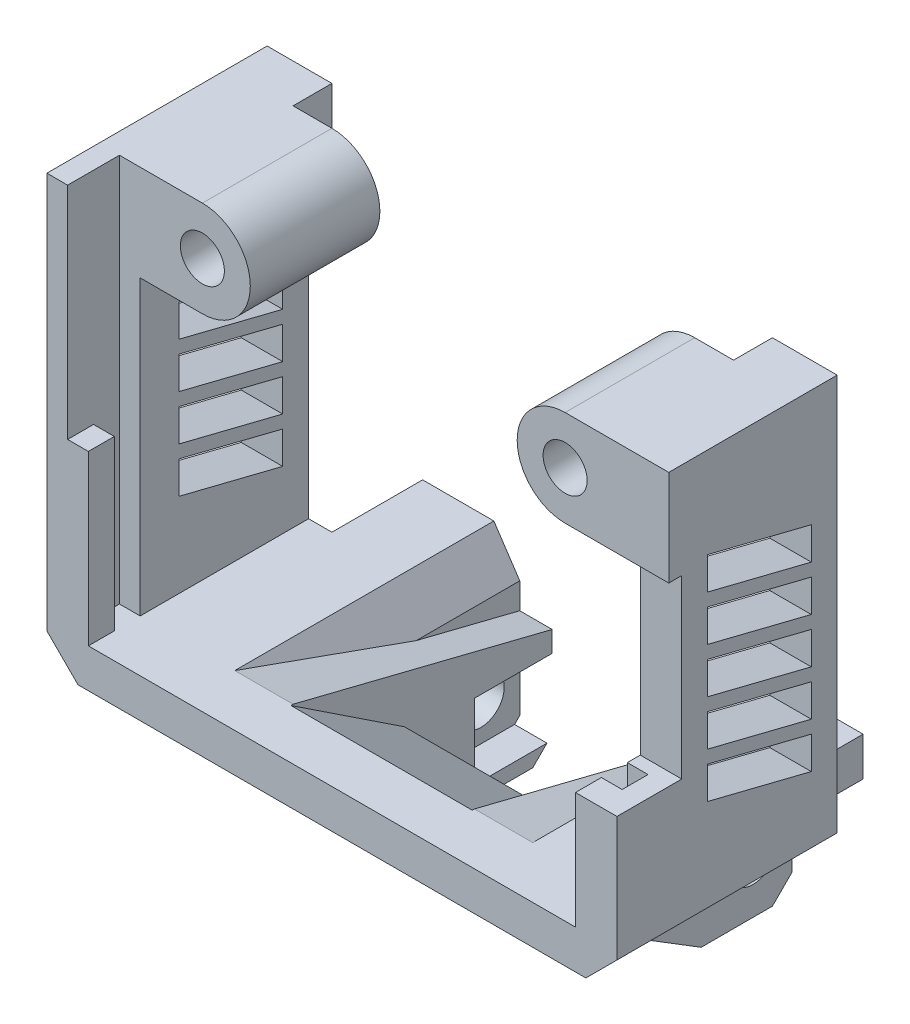
from build123d import *

# Parameters (mm, degrees)
SKETCH_1_W           = 44
SKETCH_1_H           = 34
EXTRUDE_1_DEPTH      = 24
CUT_EXTRUDE_1_DEPTH  = 31
SKETCH_5_W           = 23
SKETCH_5_H           = 10.5
EXTRUDE_4_DEPTH      = 1
EXTRUDE_5_DEPTH      = 23
SKETCH_7_R           = 1.8
CUT_EXTRUDE_2_DEPTH  = 23
CUT_EXTRUDE_4_DEPTH  = 19
CHAMFER_2_SIZE       = 2
CHAMFER_2_SIZE2      = 3
SKETCH_11_R          = 1.7
EXTRUDE_6_DEPTH      = 20
CUT_EXTRUDE_7_DEPTH  = 4
CHAMFER_3_SIZE       = 2.4
SKETCH_14_W          = 40.8
SKETCH_14_H          = 4
CUT_EXTRUDE_8_DEPTH  = 18
SKETCH_15_W          = 44
SKETCH_15_H          = 1
CUT_EXTRUDE_9_DEPTH  = 24
SKETCH_16_W          = 3.2
SKETCH_16_H          = 13.6
CUT_EXTRUDE_10_DEPTH = 5
SKETCH_17_W          = 1.6
SKETCH_17_H          = 4
CUT_EXTRUDE_11_DEPTH = 7.4
CUT_EXTRUDE_12_DEPTH = 7
SKETCH_19_W          = 1
SKETCH_19_H          = 10.5
CUT_EXTRUDE_13_DEPTH = 23
CHAMFER_4_SIZE       = 1.5
CHAMFER_5_SIZE       = 3
CHAMFER_5_SIZE2      = 2
CUT_EXTRUDE_START    = -3
SKETCH_20_W          = 14
SKETCH_20_H          = 11.956557484
CUT_EXTRUDE_14_DEPTH = 17
CHAMFER_6_SIZE       = 10
CHAMFER_6_SIZE_2     = 4
CHAMFER_7_SIZE       = 1
SKETCH_22_W          = 6.7
SKETCH_22_H          = 10
CUT_EXTRUDE_15_DEPTH = 10
SKETCH_24_W          = 6
SKETCH_24_H          = 5.8
CUT_EXTRUDE_16_DEPTH = 2.5


with BuildPart() as part:
    # Эскиз1 → Бобышка-Вытянуть1 (new body)
    with BuildSketch(Plane.XY):
        with Locations((0, 27)):
            Rectangle(SKETCH_1_W, SKETCH_1_H)
    extrude(amount=EXTRUDE_1_DEPTH)

    # Эскиз2 → Вырез-Вытянуть1 (cut)
    with BuildSketch(Plane(origin=(0, 44, 0), x_dir=(1, 0, 0), z_dir=(0, 1, 0))):
        Polygon((-18.8, 0), (18.8, 0), (18.8, -20), (20.4, -20), (20.4, -22), (18.8, -22), (18.8, -24), (-18.8, -24), (-18.8, -22), (-20.4, -22), (-20.4, -20), (-18.8, -20), align=None)
    extrude(amount=-CUT_EXTRUDE_1_DEPTH, mode=Mode.SUBTRACT)



with BuildPart() as body_2:
    # Эскиз5 → Бобышка-Вытянуть4 (new body)
    with BuildSketch(Plane(origin=(0, 0, 0), x_dir=(-1, 0, 0), z_dir=(0, 0, -1))):
        with Locations((0, 4.75)):
            Rectangle(SKETCH_5_W, SKETCH_5_H)
    extrude(amount=EXTRUDE_4_DEPTH)


with BuildPart() as part_1:
    add(part.part)

    add(body_2.part)  # Бобышка-Вытянуть5 merges body 2
    # Эскиз6 → Бобышка-Вытянуть5 (add)
    with BuildSketch(Plane(origin=(11.5, 0, 0), x_dir=(0, 0, -1), z_dir=(1, 0, 0))):
        Polygon((0, -0.5), (-7, -0.5), (-24, 10), (0, 10), align=None)
    extrude(amount=-EXTRUDE_5_DEPTH)

    # Эскиз7 → Вырез-Вытянуть2 (cut)
    with BuildSketch(Plane.ZY.offset(11.5)):
        with Locations(Location((3, 3.5, 0), (0, 0, 270))):
            Circle(SKETCH_7_R)
    extrude(amount=-CUT_EXTRUDE_2_DEPTH, mode=Mode.SUBTRACT)

    # Эскиз8 → Вырез-Вытянуть4 (cut)
    with BuildSketch(Plane.ZY.offset(9.5)):
        Polygon((0, 8), (20, 13), (0, 13), align=None)
    extrude(amount=-CUT_EXTRUDE_4_DEPTH, mode=Mode.SUBTRACT)

    # Фаска2
    chamfer_2_edges = [part_1.edges().sort_by_distance(p)[0] for p in [
        (9.5, 13, 10),
    ]]
    chamfer_2_side = [part_1.faces().sort_by_distance(p)[0] for p in [
        (-18.32664601, 13, 10),
    ]]
    chamfer(chamfer_2_edges, length=CHAMFER_2_SIZE, length2=CHAMFER_2_SIZE2, reference=chamfer_2_side[0])

    # Эскиз11 → Бобышка-Вытянуть6 (add)
    # profile 1 of 2: a face of its own
    with BuildSketch(Plane(origin=(0, 0, 0), x_dir=(-1, 0, 0), z_dir=(0, 0, -1))):
        with BuildLine():
            Line((-14, 43), (-18.8, 43))
            Line((-18.8, 43), (-18.8, 35.6))
            Line((-18.8, 35.6), (-14, 35.6))
            ThreePointArc((-14, 35.6), (-10.3, 39.3), (-14, 43))
        make_face()
        with Locations((-14, 39.3)):
            Circle(SKETCH_11_R, mode=Mode.SUBTRACT)
    # profile 2 of 2: a face of its own
    with BuildSketch(Plane(origin=(0, 0, 0), x_dir=(-1, 0, 0), z_dir=(0, 0, -1))):
        with BuildLine():
            Line((18.8, 35.6), (14, 35.6))
            ThreePointArc((14, 35.6), (10.3, 39.3), (14, 43))
            Line((14, 43), (18.8, 43))
            Line((18.8, 43), (18.8, 35.6))
        make_face()
        with Locations((14, 39.3)):
            Circle(SKETCH_11_R, mode=Mode.SUBTRACT)
    extrude(amount=-EXTRUDE_6_DEPTH)

    # Эскиз13 → Вырез-Вытянуть7 (cut)
    with BuildSketch(Plane.ZY.offset(22)):
        Polygon((9, 34), (17, 36), (17, 33.5), (9, 31.5), align=None)
        Polygon((9, 30.5), (17, 32.5), (17, 30), (9, 28), align=None)
        Polygon((9, 27), (17, 29), (17, 26.5), (9, 24.5), align=None)
        Polygon((9, 23.5), (17, 25.5), (17, 23), (9, 21), align=None)
        Polygon((9, 20), (17, 22), (17, 19.5), (9, 17.5), align=None)
    cut_extrude_7 = extrude(amount=-CUT_EXTRUDE_7_DEPTH, mode=Mode.SUBTRACT)

    # Зеркальное отражение1: Вырез-Вытянуть7 across plane
    add(cut_extrude_7.mirror(Plane(origin=(0, 0, 0), x_dir=(0, 0, 1), z_dir=(1, 0, 0))), mode=Mode.SUBTRACT)

    # Фаска3
    chamfer_3_edges = [part_1.edges().sort_by_distance(p)[0] for p in [
        (22, 10, 12),
        (-22, 10, 12),
    ]]
    chamfer(chamfer_3_edges, length=CHAMFER_3_SIZE)

    # Эскиз14 → Вырез-Вытянуть8 (cut)
    with BuildSketch(Plane(origin=(0, 44, 0), x_dir=(1, 0, 0), z_dir=(0, 1, 0))):
        with Locations((0, -22)):
            Rectangle(SKETCH_14_W, SKETCH_14_H)
    extrude(amount=-CUT_EXTRUDE_8_DEPTH, mode=Mode.SUBTRACT)

    # Эскиз15 → Вырез-Вытянуть9 (cut)
    with BuildSketch(Plane(origin=(0, 0, 0), x_dir=(-1, 0, 0), z_dir=(0, 0, -1))):
        with Locations((0, 43.5)):
            Rectangle(SKETCH_15_W, SKETCH_15_H)
    extrude(amount=-CUT_EXTRUDE_9_DEPTH, mode=Mode.SUBTRACT)

    # Эскиз16 → Вырез-Вытянуть10 (cut)
    with BuildSketch(Plane.XY.offset(24)):
        with Locations((20.4, 28.8)):
            Rectangle(SKETCH_16_W, SKETCH_16_H)
    extrude(amount=-CUT_EXTRUDE_10_DEPTH, mode=Mode.SUBTRACT)

    # Эскиз17 → Вырез-Вытянуть11 (cut)
    with BuildSketch(Plane(origin=(0, 43, 0), x_dir=(1, 0, 0), z_dir=(0, 1, 0))):
        with Locations((21.2, -22)):
            Rectangle(SKETCH_17_W, SKETCH_17_H)
    extrude(amount=-CUT_EXTRUDE_11_DEPTH, mode=Mode.SUBTRACT)

    # Эскиз18 → Вырез-Вытянуть12 (cut)
    with BuildSketch(Plane(origin=(0, 0, 0), x_dir=(-1, 0, 0), z_dir=(0, 0, -1))):
        Polygon((-22, 43), (-17, 43), (-17, 10), (-19.6, 10), (-22, 12.4), align=None)
        Polygon((22, 12.4), (19.6, 10), (17, 10), (17, 43), (22, 43), align=None)
    extrude(amount=-CUT_EXTRUDE_12_DEPTH, mode=Mode.SUBTRACT)

    # Эскиз19 → Вырез-Вытянуть13 (cut)
    with BuildSketch(Plane.ZY.offset(11.5)):
        with Locations((-0.5, 4.75)):
            Rectangle(SKETCH_19_W, SKETCH_19_H)
    extrude(amount=-CUT_EXTRUDE_13_DEPTH, mode=Mode.SUBTRACT)

    # Фаска4
    chamfer_4_edges = [part_1.edges().sort_by_distance(p)[0] for p in [
        (0, -0.5, 0),
    ]]
    chamfer(chamfer_4_edges, length=CHAMFER_4_SIZE)

    # Фаска5
    chamfer_5_edges = [part_1.edges().sort_by_distance(p)[0] for p in [
        (-9.5, 13, 10),
    ]]
    chamfer_5_side = [part_1.faces().sort_by_distance(p)[0] for p in [
        (-9.5, 11.333333333, 6.666666667),
    ]]
    chamfer(chamfer_5_edges, length=CHAMFER_5_SIZE, length2=CHAMFER_5_SIZE2, reference=chamfer_5_side[0])

    # Эскиз20 → Вырез-Вытянуть14 (cut)
    with BuildSketch(Plane(origin=(0, 0, 0), x_dir=(1, 0, 0), z_dir=(0, 1, 0)).offset(CUT_EXTRUDE_START)):
        with Locations((0, -4.591721258)):
            Rectangle(SKETCH_20_W, SKETCH_20_H)
    extrude(amount=CUT_EXTRUDE_14_DEPTH, mode=Mode.SUBTRACT)

    # Фаска6
    # the kernel refuses this chamfer: 10, 4 mm, written as the material it takes off along each edge
    with BuildSketch(Plane(origin=(7, 10.6425, 10.57), x_dir=(0, 0.254985552304956, 0.966944863017399), z_dir=(-1, 0, 0))) as chamfer_6_piece_1:
        Polygon((CHAMFER_6_SIZE * 0.999917387214, -CHAMFER_6_SIZE * 0.0128537444865), (-CHAMFER_6_SIZE_2 * 0.254985552305, -CHAMFER_6_SIZE_2 * 0.966944863017), (0, 0), align=None)
    extrude(amount=14, mode=Mode.SUBTRACT)

    # Фаска7
    chamfer_7_edges = [part_1.edges().sort_by_distance(p)[0] for p in [
        (0, 1.705, 10.57),
        (0, 6.6425, 10.57),
    ]]
    chamfer(chamfer_7_edges, length=CHAMFER_7_SIZE)

    # Эскиз22 → Вырез-Вытянуть15 (cut)
    with BuildSketch(Plane(origin=(0, 43, 0), x_dir=(1, 0, 0), z_dir=(0, 1, 0))):
        with Locations((13.65, -5)):
            Rectangle(SKETCH_22_W, SKETCH_22_H)
        with Locations((-13.65, -5)):
            Rectangle(SKETCH_22_W, SKETCH_22_H)
    extrude(amount=-CUT_EXTRUDE_15_DEPTH, mode=Mode.SUBTRACT)

    # Эскиз24 → Вырез-Вытянуть16 (cut)
    with BuildSketch(Plane(origin=(-7, 0, 0), x_dir=(0, 0, -1), z_dir=(1, 0, 0))):
        with Locations((-3, 3.5)):
            Rectangle(SKETCH_24_W, SKETCH_24_H)
    cut_extrude_16 = extrude(amount=-CUT_EXTRUDE_16_DEPTH, mode=Mode.SUBTRACT)

    # Зеркальное отражение2: Вырез-Вытянуть16 across plane
    add(cut_extrude_16.mirror(Plane(origin=(0, 0, 0), x_dir=(0, 0, 1), z_dir=(1, 0, 0))), mode=Mode.SUBTRACT)


solid = part_1.part
